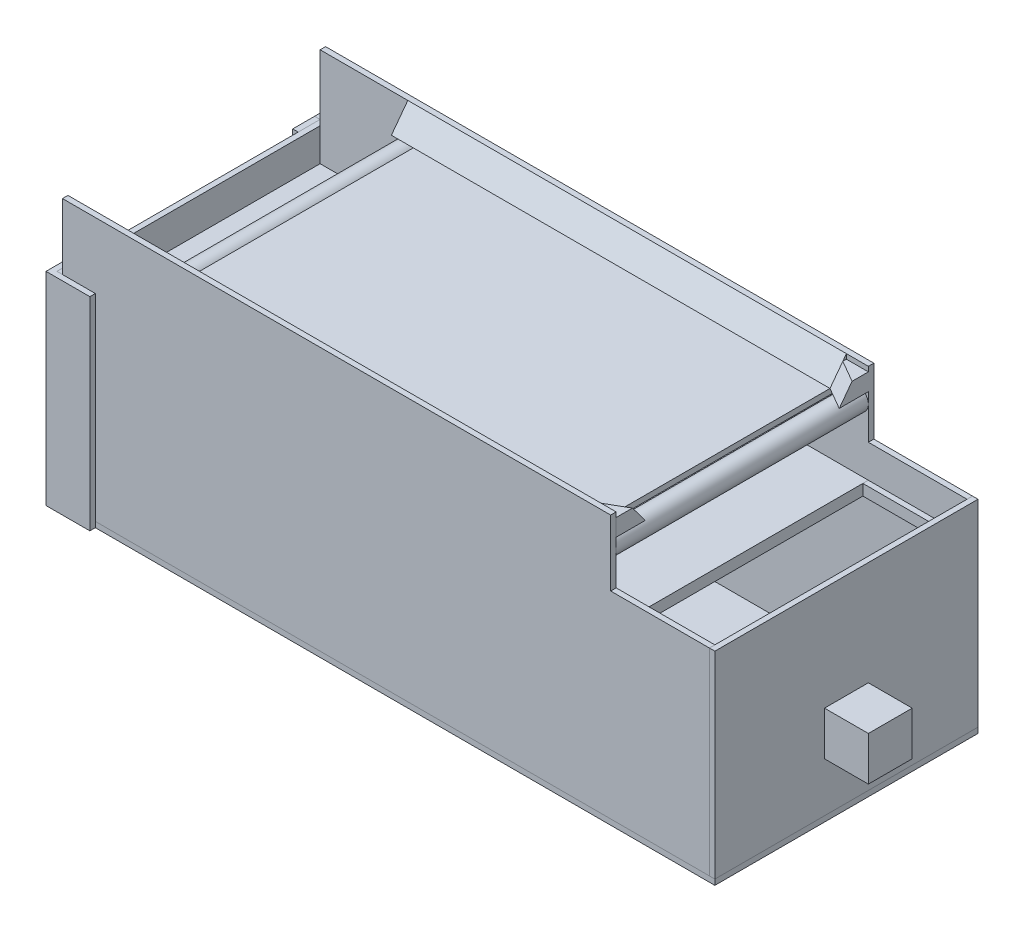
from build123d import *

# Parameters (mm, degrees)
SKETCH1_W                             = 660.4
SKETCH1_H                             = 304.8
SKETCH1_W_2                           = 101.6
FOND_DEPTH                            = 6.35
SKETCH2_W                             = 749.3
SKETCH2_H                             = 6.35
COT_S_HAUT_DEPTH                      = 228.6
COT_S_HAUT_2_DEPTH                    = 228.6
SKETCH3_W                             = 6.35
SKETCH3_H                             = 304.8
COT_ES_BAS_DEPTH                      = 228.6
COT_ES_BAS_2_DEPTH                    = 228.6
SKETCH4_W                             = 635
SKETCH4_H                             = 6.35
SUPPORT_CAGE_DEPTH                    = 76.2
SKETCH5_W                             = 6.35
SKETCH5_H                             = 12.7
SUPPORT_TRAPPE_COT_ES_DEPTH           = 114.3
SUPPORT_TRAPPE_COT_ES_2_DEPTH         = 114.3
SUPPORT_TRAPPE_DEVANT_REACH           = 609.114
SKETCH6_W                             = 6.35
SKETCH6_H                             = 12.7
PLANCHER_MILLIEU_REACH                = 612.195
SKETCH7_W                             = 635
SKETCH7_H                             = 12.7
ROULEAU_REACH                         = 612.195
SKETCH8_R                             = 12.7
SKETCH10_W                            = 482.6
SKETCH10_H                            = 6.35
SOUTIEN_TAPIS_DEPTH                   = 292.1
REBORD_START                          = -25.4
REBORD_TAPIS_DEPTH                    = 508
V_POUR_VIS_SANS_FIN_DEPTH             = 177.8
TROU_V_VIS_SANS_FIN_REACH             = 555.617
SKETCH17_W                            = 25.4
SKETCH17_H                            = 19.05
TROU_V_VIS_SANS_FIN_DIRECTION_2_REACH = 555.617
TROU_SORTIE_VIS_SANS_FIN_DEPTH        = 12.7
TROU_SORTIE_VIS_SANS_FIN_DEPTH_BACK   = 12.7
SKETCH18_W                            = 12.7
SKETCH18_H                            = 25.4
REBORD_START_2                        = -44.45
SKETCH19_W                            = 6.35
SKETCH19_H                            = 234.95
REBORD_POUR_SAC_POUBELLE_DEPTH        = 50.8
SKETCH34_W                            = 6.35
SKETCH34_H                            = 234.95
REBORD_POUR_SAC_POUBELLE_2_DEPTH      = 25.4
SKETCH31_W                            = 50.8
SKETCH31_H                            = 50.8
BOITE_MOTEUR_VIS_SANS_DEPTH           = 50.8


with BuildPart() as part:
    # Sketch1 → Fond (new body)
    with BuildSketch(Plane(origin=(0, 0, 0), x_dir=(1, 0, 0), z_dir=(0, 1, 0))):
        Rectangle(SKETCH1_W, SKETCH1_H)
        with Locations((381, 0)):
            Rectangle(SKETCH1_W_2, SKETCH1_H)
    extrude(amount=FOND_DEPTH)


with BuildPart() as body_2:
    # Sketch2 → Cotés Haut (new body)
    with BuildSketch(Plane(origin=(0, 6.35, 0), x_dir=(1, 0, 0), z_dir=(0, 1, 0))):
        with Locations((50.8, 149.225)):
            Rectangle(SKETCH2_W, SKETCH2_H)
    extrude(amount=COT_S_HAUT_DEPTH)



with BuildPart() as body_3:
    # Sketch2 → Cot_s Haut 2 (new body)
    with BuildSketch(Plane(origin=(0, 6.35, 0), x_dir=(1, 0, 0), z_dir=(0, 1, 0))):
        with Locations((50.8, -149.225)):
            Rectangle(SKETCH2_W, SKETCH2_H)
    extrude(amount=COT_S_HAUT_2_DEPTH)


with BuildPart() as body_4:
    # Sketch3 → Cotées Bas (new body)
    with BuildSketch(Plane(origin=(0, 6.35, 0), x_dir=(1, 0, 0), z_dir=(0, 1, 0))):
        with Locations((-327.025, 0)):
            Rectangle(SKETCH3_W, SKETCH3_H)
    extrude(amount=COT_ES_BAS_DEPTH)


with BuildPart() as body_5:
    # Sketch3 → Cot_es Bas 2 (new body)
    with BuildSketch(Plane(origin=(0, 6.35, 0), x_dir=(1, 0, 0), z_dir=(0, 1, 0))):
        with Locations((428.625, 0)):
            Rectangle(SKETCH3_W, SKETCH3_H)
    extrude(amount=COT_ES_BAS_2_DEPTH)

    # Sketch18 → Trou sortie vis sans fin (cut, two sides: drawn at the far end of the back side and taken through both)
    with BuildSketch(Plane.XY.offset(-TROU_SORTIE_VIS_SANS_FIN_DEPTH_BACK)):
        with Locations((431.8, 95.25)):
            Rectangle(SKETCH18_W, SKETCH18_H)
    extrude(amount=TROU_SORTIE_VIS_SANS_FIN_DEPTH + TROU_SORTIE_VIS_SANS_FIN_DEPTH_BACK, mode=Mode.SUBTRACT)


with BuildPart() as body_2_1:
    add(body_2.part)

    add(body_3.part)  # Support Cage merges body 3
    # Sketch4 → Support Cage (add)
    with BuildSketch(Plane(origin=(0, 234.95, 0), x_dir=(1, 0, 0), z_dir=(0, 1, 0))):
        with Locations((-6.35, 149.225)):
            Rectangle(SKETCH4_W, SKETCH4_H)
        with Locations((-6.35, -149.225)):
            Rectangle(SKETCH4_W, SKETCH4_H)
    extrude(amount=SUPPORT_CAGE_DEPTH)


with BuildPart() as body_5_2:
    # Sketch5 → Support Trappe cotées (new body)
    with BuildSketch(Plane.ZY.offset(-425.45)):
        with Locations((-142.875, 190.5)):
            Rectangle(SKETCH5_W, SKETCH5_H)
    extrude(amount=SUPPORT_TRAPPE_COT_ES_DEPTH)


with BuildPart() as body_6:
    # Sketch5 → Support Trappe cot_es 2 (new body)
    with BuildSketch(Plane.ZY.offset(-425.45)):
        with Locations((142.875, 190.5)):
            Rectangle(SKETCH5_W, SKETCH5_H)
    extrude(amount=SUPPORT_TRAPPE_COT_ES_2_DEPTH)


with BuildPart() as body_7:

    # Sketch6 → Support Trappe devant (new, up to next)
    with BuildSketch(Plane.XY.offset(-139.7), mode=Mode.PRIVATE) as support_trappe_devant_sk1:
        with Locations((422.275, 190.5)):
            Rectangle(SKETCH6_W, SKETCH6_H)
    support_trappe_devant_tool1 = extrude(support_trappe_devant_sk1.sketch, amount=SUPPORT_TRAPPE_DEVANT_REACH, mode=Mode.PRIVATE) - body_6.part
    add(support_trappe_devant_tool1.solids().sort_by_distance((422.275, 190.5, -139.7))[0])


with BuildPart() as body_8:

    # Sketch7 → Plancher millieu (new, up to next)
    with BuildSketch(Plane(origin=(0, 0, 146.05), x_dir=(-1, 0, 0), z_dir=(0, 0, -1)), mode=Mode.PRIVATE) as plancher_millieu_sk1:
        with Locations((6.35, 190.5)):
            Rectangle(SKETCH7_W, SKETCH7_H)
    plancher_millieu_tool1 = extrude(plancher_millieu_sk1.sketch, amount=PLANCHER_MILLIEU_REACH, mode=Mode.PRIVATE) - body_2_1.part
    add(plancher_millieu_tool1.solids().sort_by_distance((-6.35, 190.5, 146.05))[0])


with BuildPart() as body_9:

    # Sketch8 → Rouleau (new, up to next)
    with BuildSketch(Plane(origin=(0, 0, 146.05), x_dir=(-1, 0, 0), z_dir=(0, 0, -1)), mode=Mode.PRIVATE) as rouleau_sk1:
        with Locations((-298.45, 273.05)):
            Circle(SKETCH8_R)
    rouleau_tool1 = extrude(rouleau_sk1.sketch, amount=ROULEAU_REACH, mode=Mode.PRIVATE) - body_2_1.part
    rouleau = rouleau_tool1.solids().sort_by_distance((298.45, 273.05, 146.05))[0]
    add(rouleau)


with BuildPart() as body_2_2:
    add(body_2_1.part)

    # Mirror1: Rouleau across plane
    add(rouleau.mirror(Plane(origin=(44.45, 0, 0), x_dir=(0, 0, 1), z_dir=(1, 0, 0))))

    # Mirror9 2: loft between two sections, ruled curve by curve
    mirror9_2_from = [
        Edge.make_line((311.15, 305.562, -127.194303163), (311.15, 305.562, -146.05)),
        Edge.make_line((311.15, 285.75, -146.05), (311.15, 285.75, -112.335303163)),
        Edge.make_line((311.15, 285.75, -112.335303163), (311.15, 305.562, -127.194303163)),
        Edge.make_line((311.15, 285.75, -146.05), (311.15, 305.562, -146.05)),
    ]
    mirror9_2_to = [
        Edge.make_line((285.75, 305.562, -141.859), (285.75, 305.562, -146.05)),
        Edge.make_line((285.75, 285.75, -146.05), (285.75, 285.75, -127)),
        Edge.make_line((285.75, 285.75, -127), (285.75, 305.562, -141.859)),
        Edge.make_line((285.75, 285.75, -146.05), (285.75, 305.562, -146.05)),
    ]
    mirror9_2 = Solid(Shell([*[Face.make_surface_from_curves(mirror9_2_from[k], mirror9_2_to[k]) for k in range(4)], Face(Wire(mirror9_2_from)), Face(Wire(mirror9_2_to))]))
    add(mirror9_2)


with BuildPart() as body_10:
    # Sketch10 → Soutien tapis (new body)
    with BuildSketch(Plane(origin=(0, 0, 146.05), x_dir=(-1, 0, 0), z_dir=(0, 0, -1))):
        with Locations((-44.45, 282.575)):
            Rectangle(SKETCH10_W, SKETCH10_H)
    extrude(amount=SOUTIEN_TAPIS_DEPTH)


with BuildPart() as body_11:
    # Sketch11 → Rebord tapis (new body)
    with BuildSketch(Plane(origin=(311.15, 0, 0), x_dir=(0, 0, -1), z_dir=(1, 0, 0)).offset(REBORD_START)):
        Polygon((-146.05, 311.15), (-127, 285.75), (-146.05, 285.75), align=None)
    rebord_tapis = extrude(amount=-REBORD_TAPIS_DEPTH)


with BuildPart() as body_10_1:
    add(body_10.part)

    # Mirror5: Rebord tapis across plane
    add(rebord_tapis.mirror(Plane.XY))

    # Mirror9: read off the stored shape, not the designer's step
    # Mirror9: loft between two sections, ruled curve by curve
    mirror9_from = [
        Edge.make_line((311.15, 285.75, -146.05), (311.15, 285.75, -112.335303163)),
        Edge.make_line((311.15, 305.562, -127.194303163), (311.15, 305.562, -146.05)),
        Edge.make_line((311.15, 285.75, -112.335303163), (311.15, 305.562, -127.194303163)),
        Edge.make_line((311.15, 305.562, -146.05), (311.15, 285.75, -146.05)),
    ]
    mirror9_to = [
        Edge.make_line((285.75, 285.75, -146.05), (285.75, 285.75, -127)),
        Edge.make_line((285.75, 305.562, -141.859), (285.75, 305.562, -146.05)),
        Edge.make_line((285.75, 285.75, -127), (285.75, 305.562, -141.859)),
        Edge.make_line((285.75, 305.562, -146.05), (285.75, 285.75, -146.05)),
    ]
    mirror9 = Solid(Shell([*[Face.make_surface_from_curves(mirror9_from[k], mirror9_to[k]) for k in range(4)], Face(Wire(mirror9_from)), Face(Wire(mirror9_to))]))
    add(mirror9)


with BuildPart() as body_12:
    # Sketch13 → V pour vis sans fin (new body)
    with BuildSketch(Plane(origin=(0, 6.35, 0), x_dir=(1, 0, 0), z_dir=(0, 1, 0))):
        Polygon((-279.855909488, 0), (-323.85, 25.4), (-323.85, -25.4), align=None)
    extrude(amount=V_POUR_VIS_SANS_FIN_DEPTH)

    # Trou V vis sans fin: up to this face of the body (flat: up to its plane)
    trou_v_vis_sans_fin_end = Plane(body_12.part.faces().sort_by_distance((-301.852954744, 95.25, -12.7))[0])
    # Sketch17 → Trou V vis sans fin (cut, up to the picked face)
    with BuildSketch(Plane.XY, mode=Mode.PRIVATE) as trou_v_vis_sans_fin_sk1:
        with Locations((-292.555909488, 95.25)):
            Rectangle(SKETCH17_W, SKETCH17_H)
    trou_v_vis_sans_fin_tool1 = split(extrude(trou_v_vis_sans_fin_sk1.sketch, amount=-TROU_V_VIS_SANS_FIN_REACH, mode=Mode.PRIVATE), bisect_by=trou_v_vis_sans_fin_end, keep=Keep.BOTH, mode=Mode.PRIVATE)
    add(trou_v_vis_sans_fin_tool1.solids().sort_by(Axis((-292.555909, 95.25, 0), (0, 0, -1)))[0], mode=Mode.SUBTRACT)

    # Trou V vis sans fin direction 2: up to this face of the body (flat: up to its plane)
    trou_v_vis_sans_fin_direction_2_end = Plane(body_12.part.faces().sort_by_distance((-301.852954744, 95.25, 12.7))[0])
    # Sketch17 → Trou V vis sans fin direction 2 (cut, up to the picked face)
    with BuildSketch(Plane.XY, mode=Mode.PRIVATE) as trou_v_vis_sans_fin_direction_2_sk1:
        with Locations((-292.555909488, 95.25)):
            Rectangle(SKETCH17_W, SKETCH17_H)
    trou_v_vis_sans_fin_direction_2_tool1 = split(extrude(trou_v_vis_sans_fin_direction_2_sk1.sketch, amount=TROU_V_VIS_SANS_FIN_DIRECTION_2_REACH, mode=Mode.PRIVATE), bisect_by=trou_v_vis_sans_fin_direction_2_end, keep=Keep.BOTH, mode=Mode.PRIVATE)
    add(trou_v_vis_sans_fin_direction_2_tool1.solids().sort_by(Axis((-292.555909, 95.25, 0), (0, 0, 1)))[0], mode=Mode.SUBTRACT)


with BuildPart() as body_13:
    # Sketch19 → Rebord pour sac poubelle (new body)
    with BuildSketch(Plane.ZY.offset(330.2).offset(REBORD_START_2)):
        with Locations((-155.575, 117.475)):
            Rectangle(SKETCH19_W, SKETCH19_H)
    rebord_pour_sac_poubelle = extrude(amount=REBORD_POUR_SAC_POUBELLE_DEPTH)


with BuildPart() as body_14:
    # Sketch34 → Rebord pour sac poubelle 2 (new body)
    with BuildSketch(Plane.XY.offset(-152.4)):
        with Locations((-333.375, 117.475)):
            Rectangle(SKETCH34_W, SKETCH34_H)
    rebord_pour_sac_poubelle_2 = extrude(amount=REBORD_POUR_SAC_POUBELLE_2_DEPTH)


with BuildPart() as body_15:
    # Rebord tapis 2: read off the stored shape, not the designer's step
    # Rebord tapis 2: loft between two sections, ruled curve by curve
    rebord_tapis_2_from = [
        Edge.make_line((285.75, 285.75, 127), (285.75, 285.75, 146.05)),
        Edge.make_line((285.75, 285.75, 146.05), (311.15, 285.75, 146.05)),
        Edge.make_line((311.15, 285.75, 112.335303163), (285.75, 285.75, 127)),
        Edge.make_line((311.15, 285.75, 146.05), (311.15, 285.75, 112.335303163)),
    ]
    rebord_tapis_2_to = [
        Edge.make_line((285.75, 305.562, 141.859), (285.75, 305.562, 146.05)),
        Edge.make_line((285.75, 305.562, 146.05), (311.15, 305.562, 146.05)),
        Edge.make_line((311.15, 305.562, 127.194303163), (285.75, 305.562, 141.859)),
        Edge.make_line((311.15, 305.562, 146.05), (311.15, 305.562, 127.194303163)),
    ]
    rebord_tapis_2 = Solid(Shell([*[Face.make_surface_from_curves(rebord_tapis_2_from[k], rebord_tapis_2_to[k]) for k in range(4)], Face(Wire(rebord_tapis_2_from)), Face(Wire(rebord_tapis_2_to))]))
    add(rebord_tapis_2)


with BuildPart() as body_16:
    # Sketch31 → Boite moteur vis sans (new body)
    with BuildSketch(Plane(origin=(431.8, 0, 0), x_dir=(0, 0, -1), z_dir=(1, 0, 0))):
        with Locations((0, 88.9)):
            Rectangle(SKETCH31_W, SKETCH31_H)
    extrude(amount=BOITE_MOTEUR_VIS_SANS_DEPTH)


with BuildPart() as body_2_3:
    add(body_2_2.part)

    # Mirror11: Rebord pour sac poubelle across plane
    add(rebord_pour_sac_poubelle.mirror(Plane.XY))

    # Mirror18: Rebord pour sac poubelle 2 across plane
    add(rebord_pour_sac_poubelle_2.mirror(Plane.XY))


solid = Compound([part.part, body_4.part, body_5.part, body_5_2.part, body_6.part, body_7.part, body_8.part, body_9.part, body_11.part, body_10_1.part, body_12.part, body_13.part, body_14.part, body_15.part, body_16.part, body_2_3.part])
